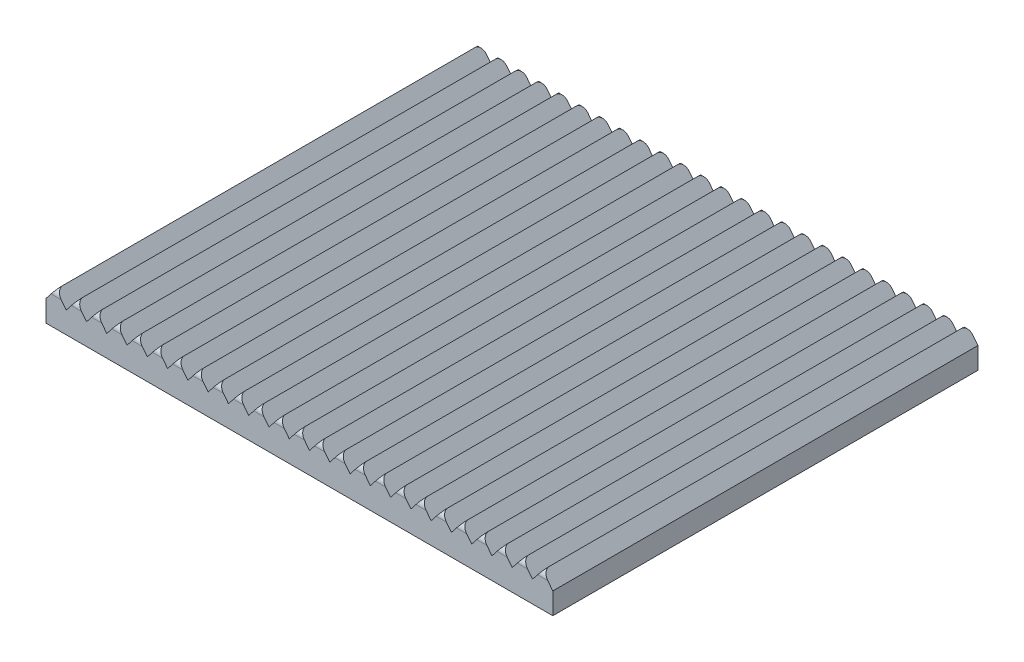
from build123d import *

# Parameters (mm, degrees)
SKETCH1_W           = 59
SKETCH1_H           = 49.5
SKETCH1_R           = 3
BOSS_EXTRUDE1_DEPTH = 1.5
BOSS_EXTRUDE2_DEPTH = 49.5
CUT_EXTRUDE1_DEPTH  = 1
CUT_EXTRUDE3_DEPTH  = 65.105869466
BOSS_EXTRUDE3_START = 0.5
SKETCH5_R           = 3
BOSS_EXTRUDE3_DEPTH = 0.5
SKETCH6_W           = 3.5
SKETCH6_H           = 2.563301414
CUT_EXTRUDE4_DEPTH  = 0.5
CHAMFER3_SIZE       = 1.5


with BuildPart() as part:
    # Sketch1 → Boss-Extrude1 (new body)
    with BuildSketch(Plane(origin=(0, 0, 0), x_dir=(1, 0, 0), z_dir=(0, 1, 0))):
        Rectangle(SKETCH1_W, SKETCH1_H)
        with Locations(Location((0, 0, 0), (0, 0, 270))):
            Circle(SKETCH1_R, mode=Mode.SUBTRACT)
    extrude(amount=BOSS_EXTRUDE1_DEPTH)

    # Sketch2 → Boss-Extrude2 (add)
    with BuildSketch(Plane(origin=(0, 0, -24.75), x_dir=(-1, 0, 0), z_dir=(0, 0, -1))):
        Polygon((-29.5, 1.5), (29.5, 1.5), (29.5, 2.5), (28.32, 4), (27.14, 2.5), (25.96, 4), (24.78, 2.5), (23.6, 4), (22.42, 2.5), (21.24, 4), (20.06, 2.5), (18.88, 4), (17.7, 2.5), (16.52, 4), (15.34, 2.5), (14.16, 4), (12.98, 2.5), (11.8, 4), (10.62, 2.5), (9.44, 4), (8.26, 2.5), (7.08, 4), (5.9, 2.5), (4.72, 4), (3.54, 2.5), (2.36, 4), (1.18, 2.5), (0, 4), (-1.18, 2.5), (-2.36, 4), (-3.54, 2.5), (-4.72, 4), (-5.9, 2.5), (-7.08, 4), (-8.26, 2.5), (-9.44, 4), (-10.62, 2.5), (-11.8, 4), (-12.98, 2.5), (-14.16, 4), (-15.34, 2.5), (-16.52, 4), (-17.7, 2.5), (-18.88, 4), (-20.06, 2.5), (-21.24, 4), (-22.42, 2.5), (-23.6, 4), (-24.78, 2.5), (-25.96, 4), (-27.14, 2.5), (-28.32, 4), (-29.5, 2.5), align=None)
    extrude(amount=-BOSS_EXTRUDE2_DEPTH)

    # Sketch3 → Cut-Extrude1 (cut)
    with BuildSketch(Plane(origin=(0, 0, 0), x_dir=(-1, 0, 0), z_dir=(0, -1, 0))):
        with BuildLine():
            Line((-1.75, -2.436698586), (-1.75, -5))
            Line((-1.75, -5), (1.75, -5))
            Line((1.75, -5), (1.75, -2.436698586))
            ThreePointArc((1.75, -2.436698586), (0, 3), (-1.75, -2.436698586))
        make_face()
    extrude(amount=-CUT_EXTRUDE1_DEPTH, mode=Mode.SUBTRACT)

    # Sketch4 → Cut-Extrude3 (cut, through all)
    with BuildSketch(Plane(origin=(29.5, 0, 0), x_dir=(0, 0, -1), z_dir=(1, 0, 0))):
        with BuildLine():
            Line((-24, 4), (-24.75, 4))
            Line((-24.75, 4), (-24.75, 3.25))
            ThreePointArc((-24.75, 3.25), (-24.530330086, 3.780330086), (-24, 4))
        make_face()
    cut_extrude3 = extrude(amount=-CUT_EXTRUDE3_DEPTH, mode=Mode.SUBTRACT)

    # Mirror1: Cut-Extrude3 across plane
    add(cut_extrude3.mirror(Plane.XY), mode=Mode.SUBTRACT)

    # Sketch5 → Boss-Extrude3 (add)
    with BuildSketch(Plane.XZ.offset(-1.5).offset(BOSS_EXTRUDE3_START)):
        Circle(SKETCH5_R)
    extrude(amount=-BOSS_EXTRUDE3_DEPTH)

    # Sketch6 → Cut-Extrude4 (cut)
    with BuildSketch(Plane.XZ.offset(-1)):
        with Locations((0, 3.718349293)):
            Rectangle(SKETCH6_W, SKETCH6_H)
    extrude(amount=-CUT_EXTRUDE4_DEPTH, mode=Mode.SUBTRACT)

    # Chamfer3
    chamfer3_edges = [part.edges().sort_by_distance(p)[0] for p in [
        (0, 0, 5),
    ]]
    chamfer(chamfer3_edges, length=CHAMFER3_SIZE - 0.0001)  # a hair under: the kernel refuses the full size


solid = part.part
